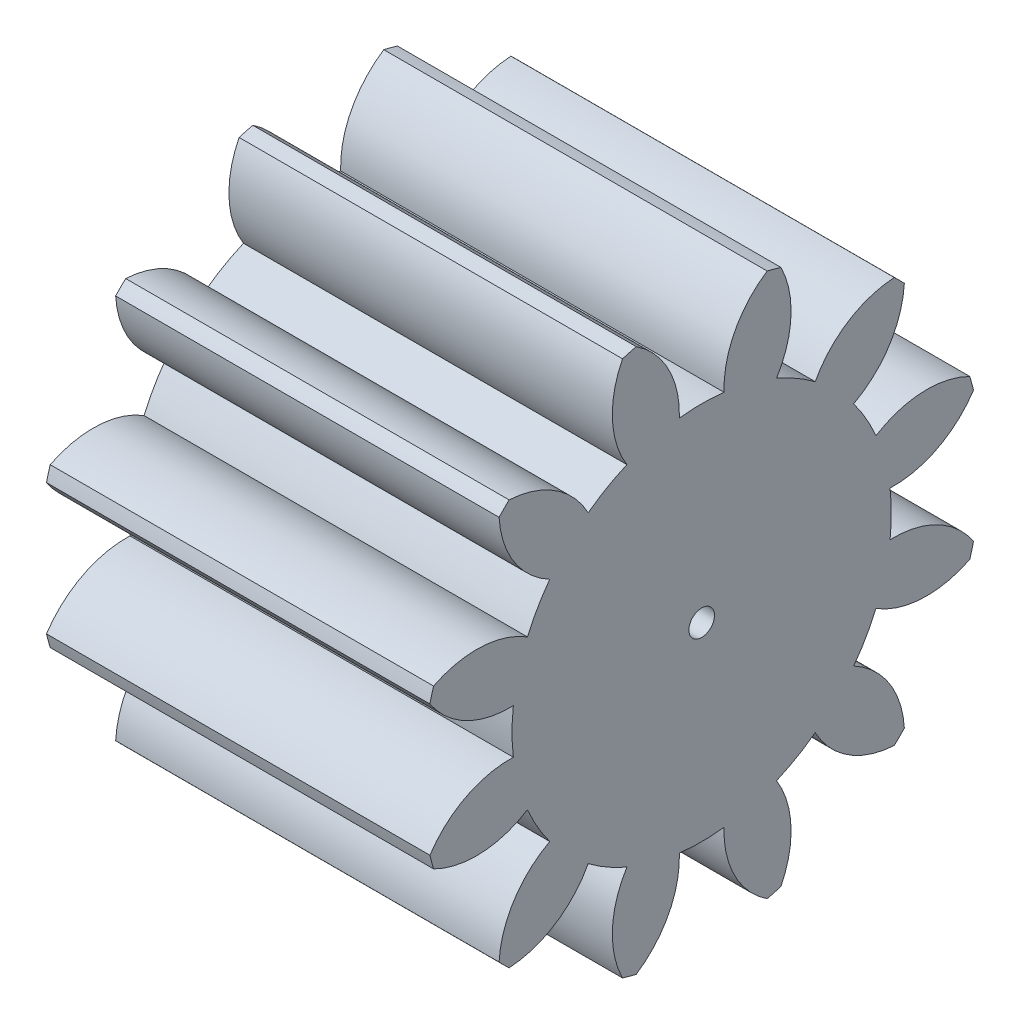
from build123d import *

# Parameters (mm, degrees)
BASPROSKE_W     = 12
BASPROSKE_H     = 8.75
TOOTHCUT_DEPTH  = 18.237314176
TEETHCUTS_COUNT = 12
TEETHCUTS_ANGLE = 330
BORSKE_R        = 0.4
BORE_DEPTH      = 50.0000508


with BuildPart() as part:
    # BasProSke → Base-Revolve (revolve)
    with BuildSketch(Plane(origin=(0, 0, 0), x_dir=(1, 0, 0), z_dir=(0, 1, 0))):
        with Locations((6, 4.375)):
            Rectangle(BASPROSKE_W, BASPROSKE_H)
    revolve(axis=Axis((-10, 0, 0), (1, 0, 0)))

    # TooCutSke → ToothCut (cut, through all)
    with BuildSketch(Plane(origin=(0, 0, 0), x_dir=(0, 0, -1), z_dir=(1, 0, 0))):
        with BuildLine():
            ThreePointArc((0.699286786, 5.895170077), (0, 5.9365), (-0.699286786, 5.895170077))
            ThreePointArc((-0.699286786, 5.895170077), (-1.040581249, 7.393099844), (-2.078649209, 8.525659073))
            ThreePointArc((-2.078649209, 8.525659073), (0, 8.7754), (2.078649209, 8.525659073))
            ThreePointArc((2.078649209, 8.525659073), (1.040581249, 7.393099844), (0.699286786, 5.895170077))
        make_face()
    toothcut = extrude(amount=TOOTHCUT_DEPTH, mode=Mode.SUBTRACT)

    # TeethCuts: ToothCut ×12 about axis
    teethcuts_axis = Axis((-10, 0, 0), (1, 0, 0))
    for i in range(1, TEETHCUTS_COUNT):
        add(toothcut.rotate(teethcuts_axis, i * TEETHCUTS_ANGLE / (TEETHCUTS_COUNT - 1)), mode=Mode.SUBTRACT)

    # BorSke → Bore (cut, symmetric)
    with BuildSketch(Plane(origin=(0, 0, 0), x_dir=(0, 0, -1), z_dir=(1, 0, 0))):
        Circle(BORSKE_R)
    extrude(amount=BORE_DEPTH, both=True, mode=Mode.SUBTRACT)


solid = part.part
